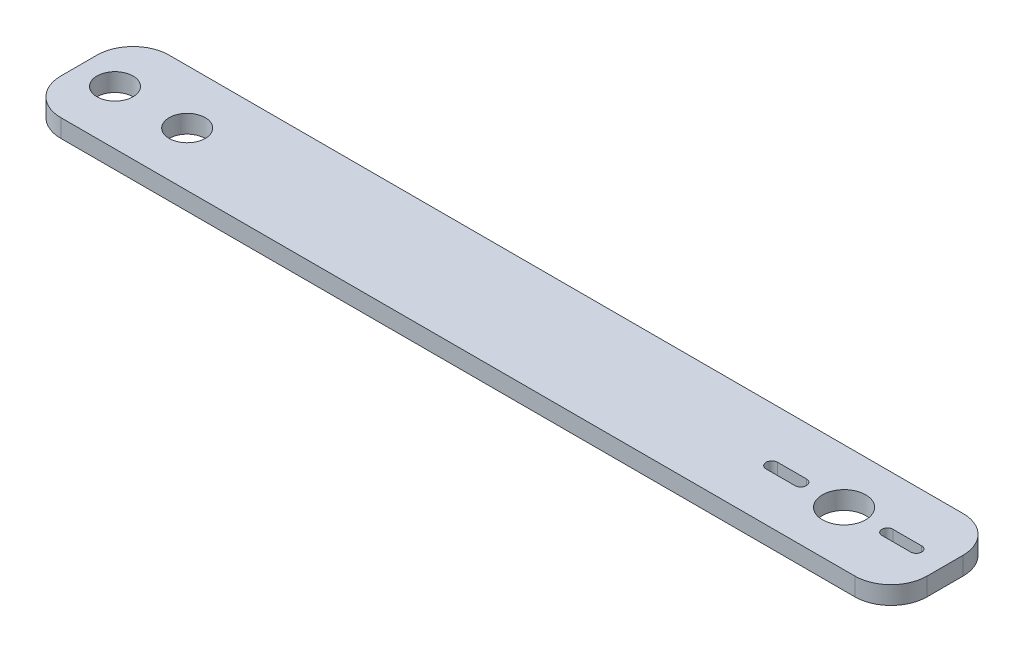
from build123d import *

# Parameters (mm, degrees)
SKETCH1_W           = 152.4
SKETCH1_H           = 19.05
BOSS_EXTRUDE1_DEPTH = 3.175
FILLET1_R           = 6.35
SKETCH2_R           = 3.175
SKETCH2_R_2         = 3.81
CUT_EXTRUDE1_DEPTH  = 100.507657605


with BuildPart() as part:
    # Sketch1 → Boss-Extrude1 (new body)
    with BuildSketch(Plane(origin=(0, 0, 0), x_dir=(1, 0, 0), z_dir=(0, 1, 0))):
        with Locations((21.802018925, 7.424854969)):
            Rectangle(SKETCH1_W, SKETCH1_H)
    extrude(amount=BOSS_EXTRUDE1_DEPTH)

    # Fillet1
    fillet1_edges = [part.edges().sort_by_distance(p)[0] for p in [
        (98.002018925, 1.5875, -16.949854969),
        (98.002018925, 1.5875, 2.100145031),
        (-54.397981075, 1.5875, -16.949854969),
        (-54.397981075, 1.5875, 2.100145031),
    ]]
    fillet(fillet1_edges, radius=FILLET1_R)

    # Sketch2 → Cut-Extrude1 (cut, through all)
    with BuildSketch(Plane(origin=(0, 3.175, 0), x_dir=(1, 0, 0), z_dir=(0, 1, 0))):
        with Locations((-48.047981075, 7.424854969)):
            Circle(SKETCH2_R)
        with Locations((-35.347981075, 7.424854969)):
            Circle(SKETCH2_R)
        with Locations((80.222018925, 7.424854969)):
            Circle(SKETCH2_R_2)
        with BuildLine():
            Line((87.842018925, 8.377354969), (92.922018925, 8.377354969))
            ThreePointArc((92.922018925, 8.377354969), (93.874518925, 7.424854969), (92.922018925, 6.472354969))
            Line((92.922018925, 6.472354969), (87.842018925, 6.472354969))
            ThreePointArc((87.842018925, 6.472354969), (86.889518925, 7.424854969), (87.842018925, 8.377354969))
        make_face()
        with BuildLine():
            Line((72.602018925, 6.408854969), (67.522018925, 6.408854969))
            ThreePointArc((67.522018925, 6.408854969), (66.506018925, 7.424854969), (67.522018925, 8.440854969))
            Line((67.522018925, 8.440854969), (72.602018925, 8.440854969))
            ThreePointArc((72.602018925, 8.440854969), (73.618018925, 7.424854969), (72.602018925, 6.408854969))
        make_face()
    extrude(amount=-CUT_EXTRUDE1_DEPTH, mode=Mode.SUBTRACT)


solid = part.part
